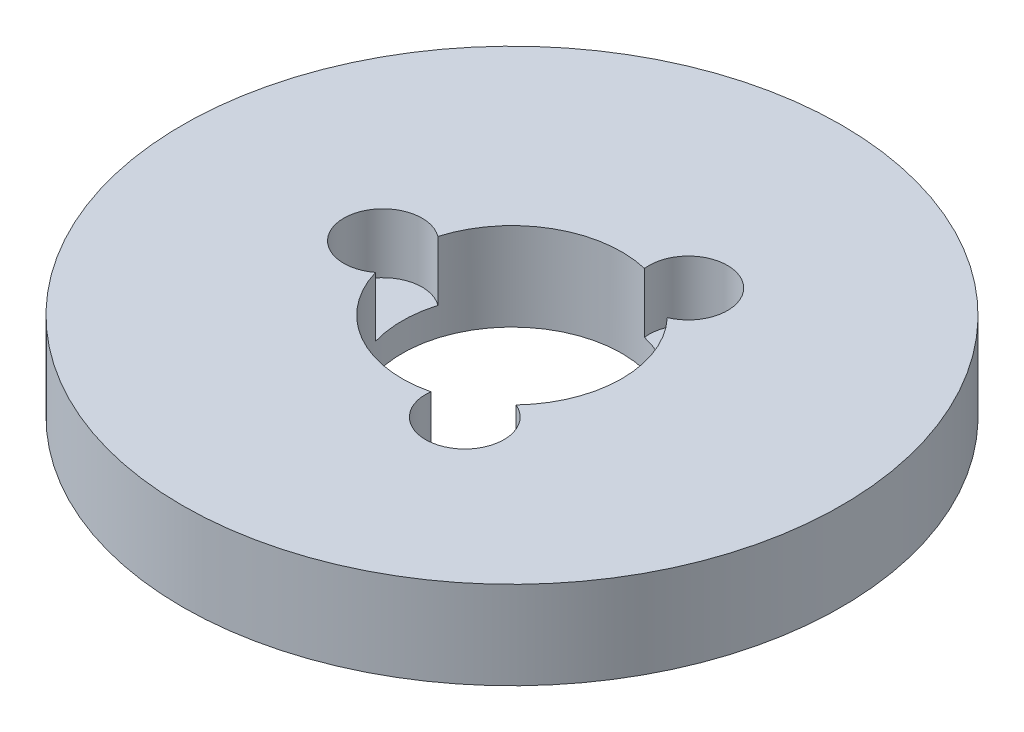
from build123d import *

# Parameters (mm, degrees)
SKETCH1_R           = 67.5
BOSS_EXTRUDE1_DEPTH = 18
SKETCH2_R           = 22.5
CUT_EXTRUDE1_DEPTH  = 98.141649152
SKETCH3_R           = 8.025014984
CUT_EXTRUDE2_DEPTH  = 12.228513101
CIRPATTERN1_COUNT   = 3


with BuildPart() as part:
    # Sketch1 → Boss-Extrude1 (new body)
    with BuildSketch(Plane(origin=(0, 0, 0), x_dir=(1, 0, 0), z_dir=(0, 1, 0))):
        Circle(SKETCH1_R)
    extrude(amount=BOSS_EXTRUDE1_DEPTH)

    # Sketch2 → Cut-Extrude1 (cut, through all)
    with BuildSketch(Plane(origin=(0, 0, 0), x_dir=(1, 0, 0), z_dir=(0, 1, 0))):
        Circle(SKETCH2_R)
    extrude(amount=CUT_EXTRUDE1_DEPTH, mode=Mode.SUBTRACT)

    # Sketch3 → Cut-Extrude2 (cut)
    with BuildSketch(Plane(origin=(0, 18, 0), x_dir=(1, 0, 0), z_dir=(0, 1, 0))):
        with Locations((-26.434472352, 0)):
            Circle(SKETCH3_R)
    cut_extrude2 = extrude(amount=-CUT_EXTRUDE2_DEPTH, mode=Mode.SUBTRACT)

    # CirPattern1: Cut-Extrude2 ×3 about axis
    cirpattern1_axis = Axis((0, 0, 0), (0, 1, 0))
    for i in range(1, CIRPATTERN1_COUNT):
        add(cut_extrude2.rotate(cirpattern1_axis, i * 360 / CIRPATTERN1_COUNT), mode=Mode.SUBTRACT)


solid = part.part
